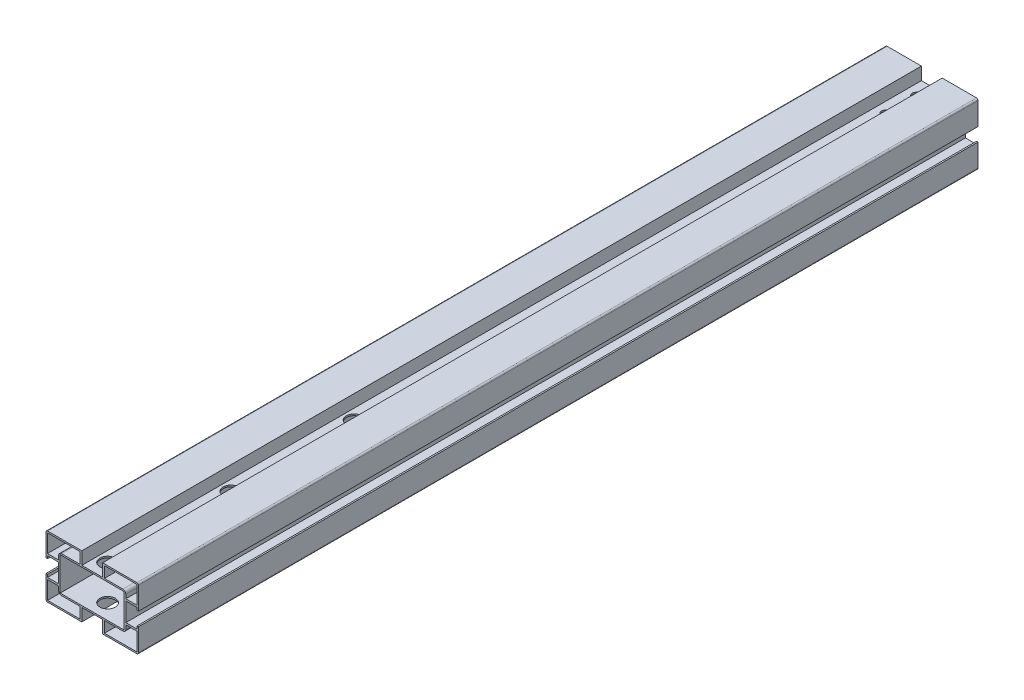
from build123d import *

# Parameters (mm, degrees)
EXTRUDE_1_DEPTH     = 545
FILLET_1_R          = 1
FILLET_2_R          = 1.95
SKETCH_3_R          = 5
CUT_EXTRUDE_1_DEPTH = 548.288285847


with BuildPart() as part:
    # 草图2 → 凸台-拉伸1 (new body)
    with BuildSketch(Plane.XY):
        Polygon((-29.99112912, -4.35), (-29.99112912, -19), (-29.99112912, -20), (-29, -20), (-6.74112912, -20), (-6.74112912, -19), (-6.74112912, -11.8), (6.74112912, -11.8), (6.74112912, -19), (6.74112912, -20), (29, -20), (29.99112912, -20), (29.99112912, -19), (29.99112912, -4.35), (29.05, -4.35), (29.042967642, -6.1), (21.81774176, -6.1), (21.81774176, 6.1), (29.042967642, 6.1), (29.05, 4.35), (29.99112912, 4.35), (29.99112912, 19), (29.99112912, 20), (29, 20), (6.74112912, 20), (6.74112912, 19), (6.74112912, 11.8), (0.00887088, 11.8), (-6.74112912, 11.8), (-6.74112912, 19), (-6.74112912, 20), (-29, 20), (-29.99112912, 20), (-29.99112912, 19), (-29.99112912, 4.35), (-29.05, 4.35), (-29.042967642, 6.1), (-21.8, 6.1), (-21.8, -6.1), (-29.042967642, -6.1), (-29.05, -4.35), align=None)
        Polygon((-21.8, -7.3), (-21.8, -11.8), (-7.94112912, -11.8), (-7.94112912, -19), (-28.99112912, -19), (-29.038145454, -7.3), align=None, mode=Mode.SUBTRACT)
        Polygon((7.94112912, -11.8), (21.81774176, -11.8), (21.81774176, -7.3), (29.038145454, -7.3), (28.99112912, -19), (7.94112912, -19), align=None, mode=Mode.SUBTRACT)
        Polygon((-7.94112912, 11.8), (-21.8, 11.8), (-21.8, 7.3), (-29.038145454, 7.3), (-28.99112912, 19), (-7.94112912, 19), align=None, mode=Mode.SUBTRACT)
        Polygon((-20.8, 10.8), (0, 10.8), (20.8, 10.8), (20.8, -10.8), (-20.8, -10.8), align=None, mode=Mode.SUBTRACT)
        Polygon((21.81774176, 7.3), (21.81774176, 11.8), (7.94112912, 11.8), (7.94112912, 19), (28.99112912, 19), (29.038145454, 7.3), align=None, mode=Mode.SUBTRACT)
    extrude(amount=EXTRUDE_1_DEPTH)

    # 圆角1
    fillet_1_edges = [part.edges().sort_by_distance(p)[0] for p in [
        (29.99112912, -20, 272.5),
        (-29.99112912, 20, 272.5),
        (-29.99112912, -20, 272.5),
        (29.99112912, 20, 272.5),
    ]]
    fillet(fillet_1_edges, radius=FILLET_1_R)

    # 圆角2
    fillet_2_edges = [part.edges().sort_by_distance(p)[0] for p in [
        (-21.8, -11.8, 272.5),
        (21.81774176, -11.8, 272.5),
        (21.81774176, 11.8, 272.5),
        (-21.8, 11.8, 272.5),
    ]]
    fillet(fillet_2_edges, radius=FILLET_2_R)

    # 草图3 → 切除-拉伸1 (cut, through all)
    with BuildSketch(Plane(origin=(0, 20, 0), x_dir=(1, 0, 0), z_dir=(0, 1, 0))):
        with BuildLine():
            ThreePointArc((2.65, -10), (1.87383297, -8.12616703), (0, -7.35))
            Line((0, -7.35), (0, -10))
            Line((0, -10), (0, -12.65))
            ThreePointArc((0, -12.65), (1.87383297, -11.87383297), (2.65, -10))
        make_face()
        with BuildLine():
            Line((0, -10), (0, -7.35))
            ThreePointArc((0, -7.35), (-2.65, -10), (0, -12.65))
            Line((0, -12.65), (0, -10))
        make_face()
        with BuildLine():
            ThreePointArc((2.65, -30), (1.87383297, -28.12616703), (0, -27.35))
            Line((0, -27.35), (0, -30))
            Line((0, -30), (0, -32.65))
            ThreePointArc((0, -32.65), (1.87383297, -31.87383297), (2.65, -30))
        make_face()
        with BuildLine():
            Line((0, -30), (0, -27.35))
            ThreePointArc((0, -27.35), (-2.65, -30), (0, -32.65))
            Line((0, -32.65), (0, -30))
        make_face()
        with BuildLine():
            ThreePointArc((2.65, -30), (1.87383297, -28.12616703), (0, -27.35))
            Line((0, -27.35), (0, -30))
            Line((0, -30), (0, -32.65))
            ThreePointArc((0, -32.65), (1.87383297, -31.87383297), (2.65, -30))
        make_face()
        with BuildLine():
            Line((0, -30), (0, -27.35))
            ThreePointArc((0, -27.35), (-2.65, -30), (0, -32.65))
            Line((0, -32.65), (0, -30))
        make_face()
        with BuildLine():
            ThreePointArc((2.65, -10), (1.87383297, -8.12616703), (0, -7.35))
            Line((0, -7.35), (0, -10))
            Line((0, -10), (0, -12.65))
            ThreePointArc((0, -12.65), (1.87383297, -11.87383297), (2.65, -10))
        make_face()
        with BuildLine():
            Line((0, -10), (0, -7.35))
            ThreePointArc((0, -7.35), (-2.65, -10), (0, -12.65))
            Line((0, -12.65), (0, -10))
        make_face()
        with Locations((0, -535)):
            Circle(SKETCH_3_R)
        with Locations((0, -455)):
            Circle(SKETCH_3_R)
        with Locations((0, -375)):
            Circle(SKETCH_3_R)
    extrude(amount=-CUT_EXTRUDE_1_DEPTH, mode=Mode.SUBTRACT)


solid = part.part
